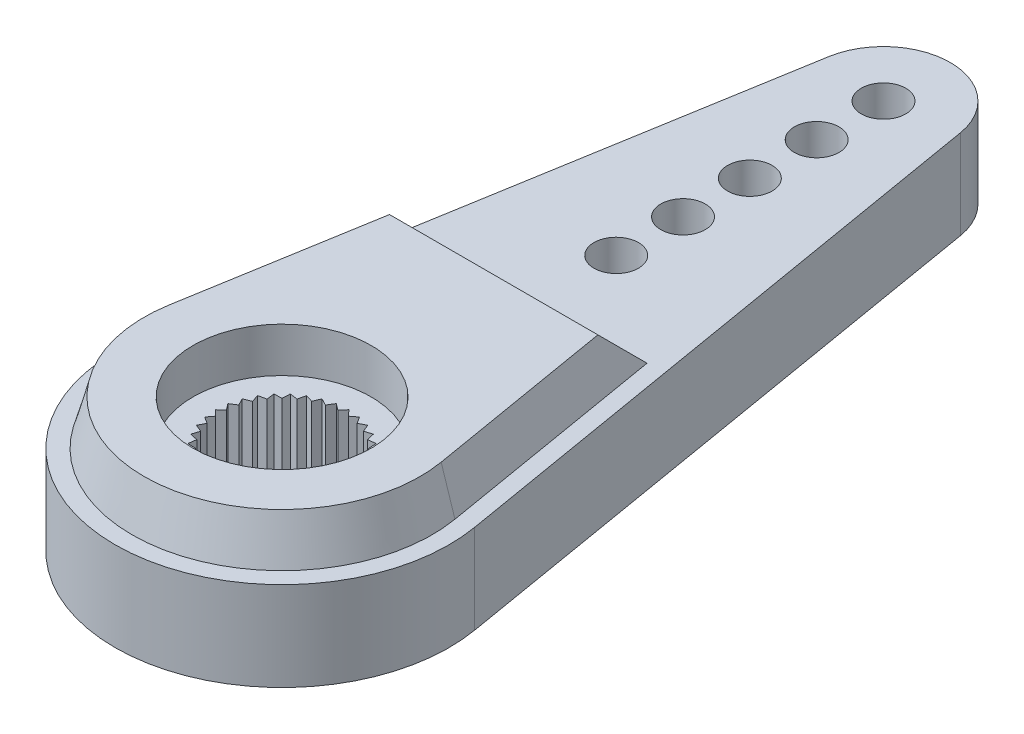
from build123d import *

# Parameters (mm, degrees)
CROQUIS1_R              = 1
SALIENTE_EXTRUIR1_DEPTH = 4
CROQUIS1_3_R            = 7
CROQUIS1_3_R_2          = 4
SALIENTE_EXTRUIR2_DEPTH = 6
CHAFL_N1_SIZE           = 3
CHAFL_N2_SIZE           = 3
CHAFL_N2_SIZE_2         = 0.803847577
SALIENTE_EXTRUIR3_DEPTH = 4
MATRIZC1_COUNT          = 36


with BuildPart() as part:
    # Croquis1 → Saliente-Extruir1 (new body)
    with BuildSketch(Plane(origin=(0, 0, 0), x_dir=(1, 0, 0), z_dir=(0, 1, 0))):
        with BuildLine():
            ThreePointArc((-7.395099729, 1.25), (0, -7.5), (7.395099729, 1.25))
            Line((7.395099729, 1.25), (2.958039892, 27.5))
            ThreePointArc((2.958039892, 27.5), (0, 30), (-2.958039892, 27.5))
            Line((-2.958039892, 27.5), (-7.395099729, 1.25))
        make_face()
        with Locations(Location((0, 24, 0), (0, 0, 270))):
            Circle(CROQUIS1_R, mode=Mode.SUBTRACT)
        with Locations(Location((0, 15, 0), (0, 0, 270))):
            Circle(CROQUIS1_R, mode=Mode.SUBTRACT)
        with Locations(Location((0, 18, 0), (0, 0, 270))):
            Circle(CROQUIS1_R, mode=Mode.SUBTRACT)
        with Locations(Location((0, 21, 0), (0, 0, 270))):
            Circle(CROQUIS1_R, mode=Mode.SUBTRACT)
        with Locations(Location((0, 27, 0), (0, 0, 270))):
            Circle(CROQUIS1_R, mode=Mode.SUBTRACT)
        with BuildLine():
            ThreePointArc((-2.988584094, 0.261467228), (-2.974334584, 0.391578577), (-2.954423259, 0.520944533))
            ThreePointArc((-2.954423259, 0.520944533), (2.974334584, -0.391578577), (-2.988584094, 0.261467228))
        make_face(mode=Mode.SUBTRACT)
    extrude(amount=SALIENTE_EXTRUIR1_DEPTH)

    # Croquis1<3> → Saliente-Extruir2 (add)
    # profile 1 of 3: a face of its own
    with BuildSketch(Plane(origin=(0, 0, 0), x_dir=(1, 0, 0), z_dir=(0, 1, 0))):
        with BuildLine():
            ThreePointArc((6.453329346, 3.82158872), (0, 7.5), (-6.453329346, 3.82158872))
            Line((-6.453329346, 3.82158872), (-6.90209308, 1.166666667))
            ThreePointArc((-6.90209308, 1.166666667), (0, 7), (6.90209308, 1.166666667))
            Line((6.90209308, 1.166666667), (6.453329346, 3.82158872))
        make_face()
    # profile 2 of 3: a face of its own
    with BuildSketch(Plane(origin=(0, 0, 0), x_dir=(1, 0, 0), z_dir=(0, 1, 0))):
        with BuildLine():
            Line((-5.662533507, 8.5), (-6.453329346, 3.82158872))
            ThreePointArc((-6.453329346, 3.82158872), (0, 7.5), (6.453329346, 3.82158872))
            Line((6.453329346, 3.82158872), (5.662533507, 8.5))
            Line((5.662533507, 8.5), (-5.662533507, 8.5))
        make_face()
    # profile 3 of 3: a face of its own
    with BuildSketch(Plane(origin=(0, 0, 0), x_dir=(1, 0, 0), z_dir=(0, 1, 0))):
        Circle(CROQUIS1_3_R)
        with Locations(Location((0, 0, 0), (0, 0, 270))):
            Circle(CROQUIS1_3_R_2, mode=Mode.SUBTRACT)
    extrude(amount=SALIENTE_EXTRUIR2_DEPTH)

    # Chaflán1
    # the kernel refuses this chamfer: 3 mm, written as the material it adds along each edge
    with BuildSketch(Plane(origin=(-13.377582471, 4, -8.5), x_dir=(0, -0.02749587661058635, -0.9996219169112968), z_dir=(1, 0, 0))) as chafl_n1_piece_1_section:
        Polygon((CHAFL_N1_SIZE * 0.999621916911, CHAFL_N1_SIZE * 0.0274958766106), (-CHAFL_N1_SIZE * 0.0274958766106, CHAFL_N1_SIZE * 0.999621916911), (0, 0), align=None)
    chafl_n1_piece_1 = extrude(amount=26.755164941, mode=Mode.PRIVATE)
    chafl_n1_piece_1 = split(chafl_n1_piece_1, bisect_by=Plane(origin=(5.328597363, 4.798690402, -10.475592868), z_dir=(-0.9860132971832695, 0, 0.16666666666666669)), keep=Keep.TOP, mode=Mode.PRIVATE)
    chafl_n1_piece_1 = split(chafl_n1_piece_1, bisect_by=Plane(origin=(-5.328597363, 4.798690402, -10.475592868), z_dir=(0.9860132971832695, 0, 0.16666666666666669)), keep=Keep.TOP, mode=Mode.PRIVATE)
    chafl_n1_piece_1 = split(chafl_n1_piece_1, bisect_by=Plane(origin=(0, 6, -9.574895522), z_dir=(0, -1, 0)), keep=Keep.TOP, mode=Mode.PRIVATE)
    add(chafl_n1_piece_1)

    # Chaflán2
    # the kernel refuses this chamfer: 3, 0.803847577 mm, written as the material it takes off along each edge
    with BuildSketch(Plane(origin=(6.90209308, 6, -1.166666667), x_dir=(0.00982773906125155, -0.9999503267608272, -0.0016611910963950731), z_dir=(-0.1666666666666078, 0, -0.9860132971832793))) as chafl_n2_piece_1_section:
        Polygon((CHAFL_N2_SIZE * 0.999950326761, CHAFL_N2_SIZE * 0.00996714657715), (-CHAFL_N2_SIZE_2 * 0.00996714658201, CHAFL_N2_SIZE_2 * 0.999950327126), (0, 0), align=None)
    chafl_n2_piece_1 = extrude(amount=16.241707258, mode=Mode.PRIVATE)
    chafl_n2_piece_1 = split(chafl_n2_piece_1, bisect_by=Plane(origin=(5.281191702, 4, -9.128733123), z_dir=(0, 1, 0)), keep=Keep.TOP, mode=Mode.PRIVATE)
    add(chafl_n2_piece_1, mode=Mode.SUBTRACT)
    with BuildSketch(Plane(origin=(-6.90209308, 6, -1.166666667), x_dir=(0.976646209142954, 0.13751244702122697, 0.16508333980426884), z_dir=(0.1666666666666078, 0, -0.9860132971832793))) as chafl_n2_piece_2_section:
        Polygon((CHAFL_N2_SIZE_2 * 0.990500039187, CHAFL_N2_SIZE_2 * 0.137512447071), (-CHAFL_N2_SIZE * 0.137512447022, CHAFL_N2_SIZE * 0.990500038826), (0, 0), align=None)
    chafl_n2_piece_2 = extrude(amount=16.241707258, mode=Mode.PRIVATE)
    chafl_n2_piece_2 = split(chafl_n2_piece_2, bisect_by=Plane(origin=(-5.281191702, 4, -9.128733123), z_dir=(0, 1, 0)), keep=Keep.TOP, mode=Mode.PRIVATE)
    add(chafl_n2_piece_2, mode=Mode.SUBTRACT)
    with BuildSketch(Plane(origin=(0, 6, 0), x_dir=(0.9860132971832691, 0, -0.16666666666666757), z_dir=(-0.16666666666666757, 0, -0.9860132971832691))) as chafl_n2_piece_3_section:
        Polygon((7, CHAFL_N2_SIZE), (7 - CHAFL_N2_SIZE_2, 0), (7, 0), align=None)
    chafl_n2_piece_3 = revolve(axis=Axis((0, 6, 0), (0, -1, 0)), revolution_arc=199.188136454, mode=Mode.PRIVATE)
    chafl_n2_piece_3 = split(chafl_n2_piece_3, bisect_by=Plane(origin=(0, 4, 6.478370391), z_dir=(0, 1, 0)), keep=Keep.TOP, mode=Mode.PRIVATE)
    add(chafl_n2_piece_3, mode=Mode.SUBTRACT)

    # Croquis1<4> → Saliente-Extruir3 (add)
    with BuildSketch(Plane(origin=(0, 0, 0), x_dir=(1, 0, 0), z_dir=(0, 1, 0))):
        with BuildLine():
            Line((-3, 0), (-2.73953542, 0.239678293))
            Line((-2.73953542, 0.239678293), (-2.988584094, 0.261467228))
            ThreePointArc((-2.988584094, 0.261467228), (-2.997144665, 0.130858162), (-3, 0))
        make_face()
        with BuildLine():
            Line((-2.988584094, 0.261467228), (-2.73953542, 0.239678293))
            Line((-2.73953542, 0.239678293), (-2.954423259, 0.520944533))
            ThreePointArc((-2.954423259, 0.520944533), (-2.974334584, 0.391578577), (-2.988584094, 0.261467228))
        make_face()
    saliente_extruir3 = extrude(amount=SALIENTE_EXTRUIR3_DEPTH)

    # MatrizC1: Saliente-Extruir3 ×36 about axis
    matrizc1_axis = Axis((0, 0, 0), (0, 1, 0))
    for i in range(1, MATRIZC1_COUNT):
        add(saliente_extruir3.rotate(matrizc1_axis, i * 360 / MATRIZC1_COUNT))


solid = part.part
